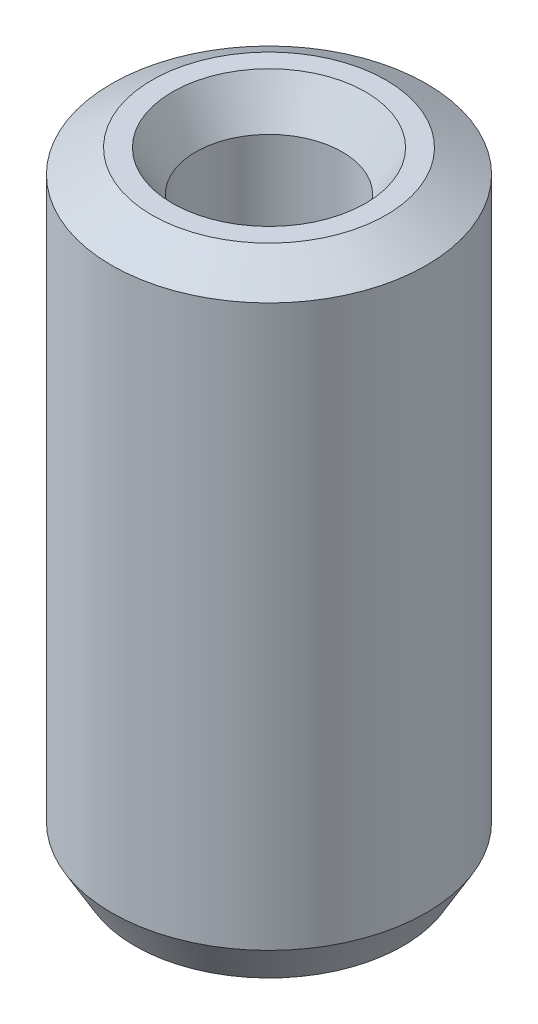
from build123d import *
from OCP.BRepFilletAPI import BRepFilletAPI_MakeChamfer

# Parameters (mm, degrees)
SKETCH1_R           = 5
BOSS_EXTRUDE1_DEPTH = 19.83572663
SKETCH2_R           = 2.328309237
CUT_EXTRUDE1_DEPTH  = 22.05839621
CHAMFER1_SIZE       = 0.740194152
CHAMFER1_SIZE2      = 1.28205388


with BuildPart() as part:
    # Sketch1 → Boss-Extrude1 (new body)
    with BuildSketch(Plane(origin=(0, 0, 0), x_dir=(1, 0, 0), z_dir=(0, 1, 0))):
        Circle(SKETCH1_R)
    extrude(amount=BOSS_EXTRUDE1_DEPTH)

    # Sketch2 → Cut-Extrude1 (cut, through all)
    with BuildSketch(Plane(origin=(0, 0, 0), x_dir=(1, 0, 0), z_dir=(0, 1, 0))):
        Circle(SKETCH2_R)
    extrude(amount=CUT_EXTRUDE1_DEPTH, mode=Mode.SUBTRACT)

    # Chamfer1: one chamfer whose edges measure the first distance from different faces: ONE call of the kernel's chamfer builder (chamfer() names one face for all edges)
    chamfer1_edges_1 = [part.edges().sort_by_distance(p)[0] for p in [
        (-2.328309237, 19.83572663, 0),
    ]]
    chamfer1_side_1 = [part.faces().sort_by_distance(p)[0] for p in [
        (-4.858578644, 19.83572663, 0),
    ]]
    chamfer1_edges_2 = [part.edges().sort_by_distance(p)[0] for p in [
        (-2.328309237, 0, 0),
    ]]
    chamfer1_side_2 = [part.faces().sort_by_distance(p)[0] for p in [
        (-2.328309237, 9.917863315, 0),
    ]]
    chamfer1_edges_3 = [part.edges().sort_by_distance(p)[0] for p in [
        (-5, 0, 0),
    ]]
    chamfer1_side_3 = [part.faces().sort_by_distance(p)[0] for p in [
        (-4.858578644, 0, 0),
    ]]
    chamfer1_edges_4 = [part.edges().sort_by_distance(p)[0] for p in [
        (-5, 19.83572663, 0),
    ]]
    chamfer1_side_4 = [part.faces().sort_by_distance(p)[0] for p in [
        (-5, 9.917863315, 0),
    ]]
    chamfer1 = BRepFilletAPI_MakeChamfer(part.part.solid().wrapped)
    for e in chamfer1_edges_1:
        chamfer1.Add(CHAMFER1_SIZE, CHAMFER1_SIZE2, e.wrapped, chamfer1_side_1[0].wrapped)  # the first distance lies on this face
    for e in chamfer1_edges_2:
        chamfer1.Add(CHAMFER1_SIZE, CHAMFER1_SIZE2, e.wrapped, chamfer1_side_2[0].wrapped)  # the first distance lies on this face
    for e in chamfer1_edges_3:
        chamfer1.Add(CHAMFER1_SIZE, CHAMFER1_SIZE2, e.wrapped, chamfer1_side_3[0].wrapped)  # the first distance lies on this face
    for e in chamfer1_edges_4:
        chamfer1.Add(CHAMFER1_SIZE, CHAMFER1_SIZE2, e.wrapped, chamfer1_side_4[0].wrapped)  # the first distance lies on this face
    add(Compound.cast(chamfer1.Shape()), mode=Mode.REPLACE)


solid = part.part
